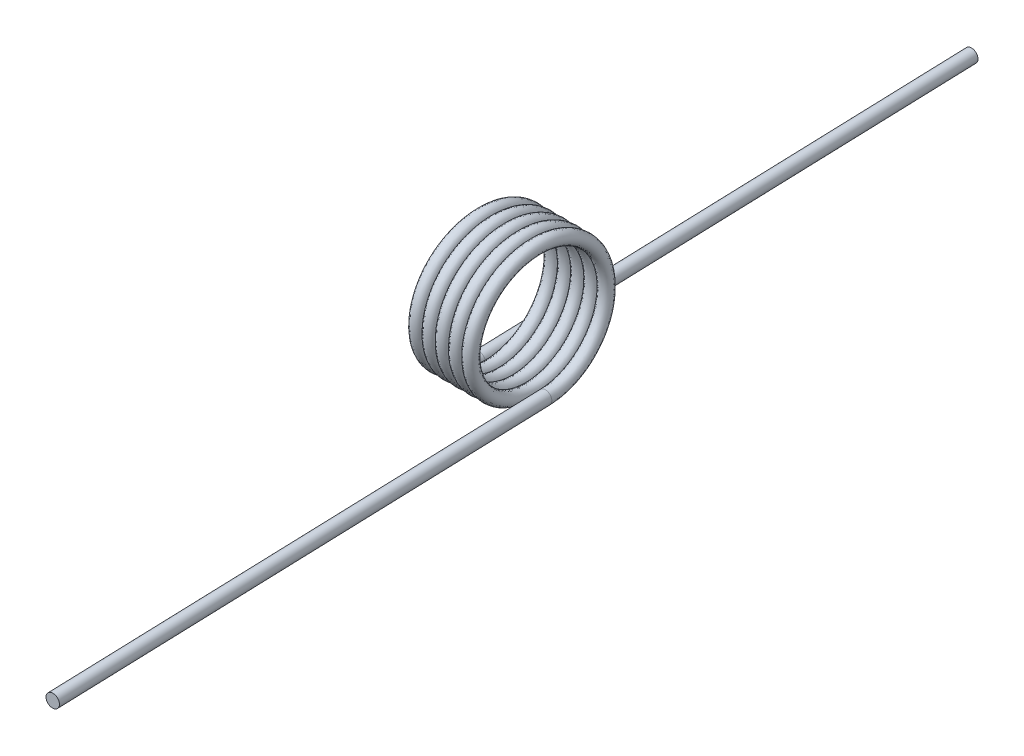
from build123d import *

# Parameters (mm, degrees)
SWEEP1_PITCH   = 1.3208
SKETCH4_R      = 0.6477
EXTRUDE1_DEPTH = 50.8
SKETCH5_R      = 0.6477
EXTRUDE2_DEPTH = 50.8


with BuildPart() as part:
    # Sweep1: arcs per turn and ends read off the stored shape
    # Sweep1: the profile of Sketch3 screwed along a left-hand helix through 5 turns, 6 arcs to a turn; built about Z, then put on its axis
    sweep1_z = Axis((0, 0, 0), (0, 0, 1))
    sweep1_corners = [(6.428550041, -0.021212193, -0.647177587), (7.061025124, 0.000493022, 0.015041963), (6.398449959, 0.021212193, 0.647177587), (5.765974876, -0.000493022, -0.015041963)]
    with BuildLine(mode=Mode.PRIVATE) as sweep1_profile:
        ThreePointArc((6.428550041, -0.021212193, -0.647177587), (6.882011392, -0.014650666, -0.446987386), (7.061025124, 0.000493022, 0.015041963))
        ThreePointArc((7.061025124, 0.000493022, 0.015041963), (6.86072742, 0.015347905, 0.468259935), (6.398449959, 0.021212193, 0.647177587))
        ThreePointArc((6.398449959, 0.021212193, 0.647177587), (5.944988608, 0.014650666, 0.446987386), (5.765974876, -0.000493022, -0.015041963))
        ThreePointArc((5.765974876, -0.000493022, -0.015041963), (5.96627258, -0.015347905, -0.468259935), (6.428550041, -0.021212193, -0.647177587))
    sweep1_cap = Face(sweep1_profile.wire())
    sweep1_arcs = [((6.428550041, -0.021212193, -0.647177587), (7.076075165, -0.02071917, -0.632135624), (7.061025124, 0.000493022, 0.015041963), (1, 0.7071067811865476, 1)), ((7.061025124, 0.000493022, 0.015041963), (7.045975083, 0.021705215, 0.66221955), (6.398449959, 0.021212193, 0.647177587), (1, 0.7071067811865476, 1)), ((6.398449959, 0.021212193, 0.647177587), (5.750924835, 0.02071917, 0.632135624), (5.765974876, -0.000493022, -0.015041963), (1, 0.7071067811865476, 1)), ((5.765974876, -0.000493022, -0.015041963), (5.781024917, -0.021705215, -0.66221955), (6.428550041, -0.021212193, -0.647177587), (1, 0.7071067811865476, 1))]  # start, shoulder, end, weights
    sweep1_turn_angles = [0, -30, -60, -90, -120, -150, -180, -210, -240, -270, -300, -330, -360]
    sweep1_turn_weights = [1, 0.8660254037844387, 1, 0.8660254037844387, 1, 0.8660254037844387, 1, 0.8660254037844387, 1, 0.8660254037844387, 1, 0.8660254037844387, 1]
    sweep1_turn_sides = [Face.make_bezier_surface([[Vector(p[j][0], p[j][1], 0).rotate(sweep1_z, sweep1_turn_angles[2 * i + k]) / sweep1_turn_weights[2 * i + k] + Vector(0, 0, p[j][2] + -SWEEP1_PITCH * sweep1_turn_angles[2 * i + k] / 360) for k in range(3)] for j in range(3)], [[p[3][j] * sweep1_turn_weights[2 * i + k] for k in range(3)] for j in range(3)]) for p in sweep1_arcs for i in range(6)]
    sweep1 = Plane(origin=(0, 0, 0), x_dir=(0, -1, 0), z_dir=(-1, 0, 0)) * Solid(Shell([*[p.moved(Location((0, 0, SWEEP1_PITCH * i))) for i in range(5) for p in sweep1_turn_sides], sweep1_cap, sweep1_cap.rotate(sweep1_z, -1800).moved(Location((0, 0, -SWEEP1_PITCH * -1800 / 360)))]))
    add(sweep1)

    # Sketch4 → Extrude1 (add)
    with BuildSketch(Plane(origin=(0, 0, 0), x_dir=(-0.9991934337390496, 0.02323612909274789, 0.0327500271382012), z_dir=(0.03275887187952178, -9.353520562249695e-15, 0.9994632841246252))):
        with Locations(Location((-0.149024914, 6.411768385, 0), (0, 0, 1.33145196))):
            Circle(SKETCH4_R)
    extrude(amount=EXTRUDE1_DEPTH)

    # Sketch5 → Extrude2 (add)
    with BuildSketch(Plane(origin=(-0.007087041, 0, -0.216223477), x_dir=(0.9984567745811239, 0.04486742623222504, -0.03272588205617523), z_dir=(-0.03275887187952177, 7.896266106255379e-14, -0.9994632841246252))):
        with Locations(Location((-6.881565777, 6.110895833, 0), (0, 0, 182.571577455))):
            Circle(SKETCH5_R)
    extrude(amount=EXTRUDE2_DEPTH)


solid = part.part
